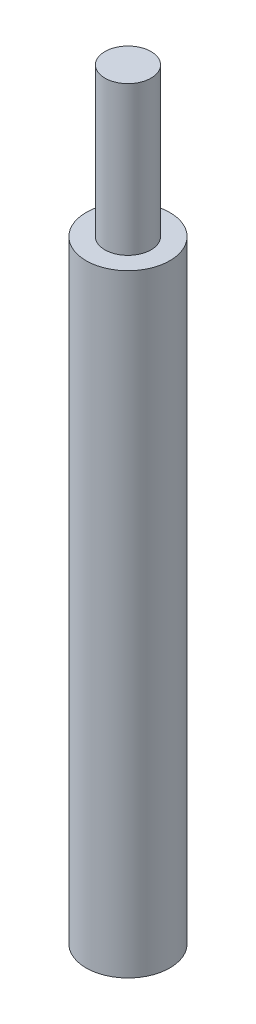
from build123d import *

# Parameters (mm, degrees)
SKETCH1_R                  = 7.14375
BOSS_EXTRUDE1_DEPTH        = 130
M10X1_0_TAPPED_HOLE1_D     = 9
M10X1_0_TAPPED_HOLE1_DEPTH = 15
M10X1_0_TAPPED_HOLE1_TIP   = 2.703872786
CUT_EXTRUDE1_START         = -25.4
SKETCH4_R                  = 7.14375
SKETCH4_R_2                = 3.937
CUT_EXTRUDE1_DEPTH         = 25.4


with BuildPart() as part:
    # Sketch1 → Boss-Extrude1 (new body)
    with BuildSketch(Plane(origin=(0, 0, 0), x_dir=(1, 0, 0), z_dir=(0, 1, 0))):
        Circle(SKETCH1_R)
    extrude(amount=BOSS_EXTRUDE1_DEPTH)

    # M10x1.0 Tapped Hole1
    with Locations(Plane.XZ):
        with Locations((0, 0)):
            Hole(M10X1_0_TAPPED_HOLE1_D / 2, depth=M10X1_0_TAPPED_HOLE1_DEPTH)
            with Locations((0, 0, -(M10X1_0_TAPPED_HOLE1_DEPTH + M10X1_0_TAPPED_HOLE1_TIP / 2))):  # 118° drill point
                Cone(0, M10X1_0_TAPPED_HOLE1_D / 2, M10X1_0_TAPPED_HOLE1_TIP, mode=Mode.SUBTRACT)

    # Sketch4 → Cut-Extrude1 (cut)
    with BuildSketch(Plane(origin=(0, 130, 0), x_dir=(1, 0, 0), z_dir=(0, 1, 0)).offset(CUT_EXTRUDE1_START)):
        Circle(SKETCH4_R)
        Circle(SKETCH4_R_2, mode=Mode.SUBTRACT)
    extrude(amount=CUT_EXTRUDE1_DEPTH, mode=Mode.SUBTRACT)


solid = part.part
